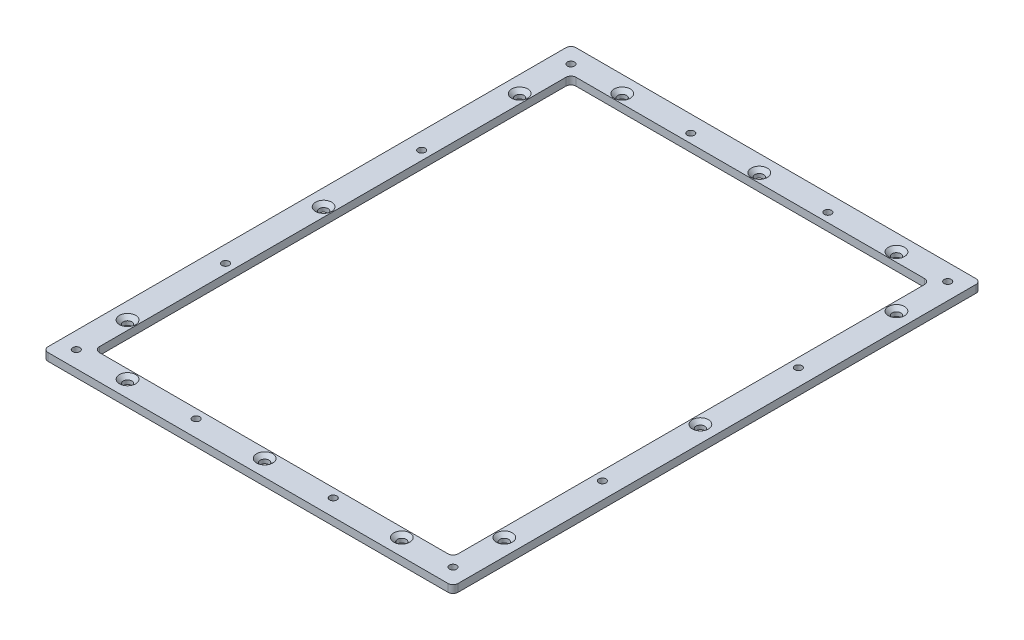
from build123d import *

# Parameters (mm, degrees)
SKETCH1_W                                      = 160
SKETCH1_H                                      = 206
SKETCH1_W_2                                    = 140
SKETCH1_H_2                                    = 186
BOSS_EXTRUDE1_DEPTH                            = 3
FILLET1_R                                      = 2
BOSS_EXTRUDE3_DEPTH                            = 0.5
FILLET2_R                                      = 0.25
SKETCH10_R                                     = 1.7
SKETCH10_R_2                                   = 1.4
CUT_EXTRUDE1_DEPTH                             = 131.465512684
CSK_FOR_M3_FLAT_HEAD_MACHINE_SCREW2_AT_2_COUNT = 2
CSK_FOR_M3_FLAT_HEAD_MACHINE_SCREW2_AT_2_PITCH = 53.5
CSK_FOR_M3_FLAT_HEAD_MACHINE_SCREW2_AT_3_COUNT = 2
CSK_FOR_M3_FLAT_HEAD_MACHINE_SCREW2_AT_3_PITCH = 28.284271247
CSK_FOR_M3_FLAT_HEAD_MACHINE_SCREW2_AT_4_COUNT = 2
CSK_FOR_M3_FLAT_HEAD_MACHINE_SCREW2_AT_4_PITCH = 107
CSK_FOR_M3_FLAT_HEAD_MACHINE_SCREW2_AT_5_COUNT = 2
CSK_FOR_M3_FLAT_HEAD_MACHINE_SCREW2_AT_5_PITCH = 128.565158577
CSK_FOR_M3_FLAT_HEAD_MACHINE_SCREW2_AT_6_COUNT = 2
CSK_FOR_M3_FLAT_HEAD_MACHINE_SCREW2_AT_6_PITCH = 159.503134765
CSK_FOR_M3_FLAT_HEAD_MACHINE_SCREW2_AT_7_COUNT = 2
CSK_FOR_M3_FLAT_HEAD_MACHINE_SCREW2_AT_7_PITCH = 220.676233428
CSK_FOR_M3_FLAT_HEAD_MACHINE_SCREW2_AT_8_COUNT = 2
CSK_FOR_M3_FLAT_HEAD_MACHINE_SCREW2_AT_8_PITCH = 200.277931885
CSK_FOR_M3_FLAT_HEAD_MACHINE_SCREW2_AT_9_COUNT = 2
CSK_FOR_M3_FLAT_HEAD_MACHINE_SCREW2_AT_9_PITCH = 193
CSK_FOR_M3_FLAT_HEAD_MACHINE_SCREW2_AT_1_COUNT = 2
CSK_FOR_M3_FLAT_HEAD_MACHINE_SCREW2_AT_1_PITCH = 174.152232257
CSK_FOR_M3_FLAT_HEAD_MACHINE_SCREW2_2_COUNT    = 2
CSK_FOR_M3_FLAT_HEAD_MACHINE_SCREW2_2_PITCH    = 214.611276498
CSK_FOR_M3_FLAT_HEAD_MACHINE_SCREW2_3_COUNT    = 2
CSK_FOR_M3_FLAT_HEAD_MACHINE_SCREW2_3_PITCH    = 98.550748348


with BuildPart() as part:
    # Sketch1 → Boss-Extrude1 (new body)
    with BuildSketch(Plane(origin=(0, 0, 0), x_dir=(1, 0, 0), z_dir=(0, 1, 0))):
        Rectangle(SKETCH1_W, SKETCH1_H)
        Rectangle(SKETCH1_W_2, SKETCH1_H_2, mode=Mode.SUBTRACT)
    extrude(amount=BOSS_EXTRUDE1_DEPTH)

    # Fillet1
    fillet1_edges = [part.edges().sort_by_distance(p)[0] for p in [
        (70, 1.5, 93),
        (70, 1.5, -93),
        (-70, 1.5, -93),
        (-70, 1.5, 93),
        (-80, 1.5, -103),
        (80, 1.5, -103),
        (80, 1.5, 103),
        (-80, 1.5, 103),
    ]]
    fillet(fillet1_edges, radius=FILLET1_R)

    # Sketch6 → Boss-Extrude3 (add)
    with BuildSketch(Plane.XZ):
        with BuildLine():
            Line((-78, -102), (78, -102))
            ThreePointArc((78, -102), (78.707106781, -101.707106781), (79, -101))
            Line((79, -101), (79, 101))
            ThreePointArc((79, 101), (78.707106781, 101.707106781), (78, 102))
            Line((78, 102), (-78, 102))
            ThreePointArc((-78, 102), (-78.707106781, 101.707106781), (-79, 101))
            Line((-79, 101), (-79, -101))
            ThreePointArc((-79, -101), (-78.707106781, -101.707106781), (-78, -102))
        make_face()
        with BuildLine():
            Line((-78, -101.5), (78, -101.5))
            ThreePointArc((78, -101.5), (78.353553391, -101.353553391), (78.5, -101))
            Line((78.5, -101), (78.5, 101))
            ThreePointArc((78.5, 101), (78.353553391, 101.353553391), (78, 101.5))
            Line((78, 101.5), (-78, 101.5))
            ThreePointArc((-78, 101.5), (-78.353553391, 101.353553391), (-78.5, 101))
            Line((-78.5, 101), (-78.5, -101))
            ThreePointArc((-78.5, -101), (-78.353553391, -101.353553391), (-78, -101.5))
        make_face(mode=Mode.SUBTRACT)
    extrude(amount=BOSS_EXTRUDE3_DEPTH)

    # Fillet2
    fillet2_edges = [part.edges().sort_by_distance(p)[0] for p in [
        (-78.353553391, 0, -101.353553391),
        (-78.5, 0, 0),
        (-78.353553391, 0, 101.353553391),
        (0, 0, 101.5),
        (78.353553391, 0, 101.353553391),
        (78.5, 0, 0),
        (78.353553391, 0, -101.353553391),
        (-78.707106781, 0, -101.707106781),
        (-79, 0, 0),
        (-78.707106781, 0, 101.707106781),
        (0, 0, 102),
        (78.707106781, 0, 101.707106781),
        (79, 0, 0),
        (78.707106781, 0, -101.707106781),
        (0, 0, -101.5),
        (0, 0, -102),
    ]]
    fillet(fillet2_edges, radius=FILLET2_R)
    fillet2_2_edges = [part.edges().sort_by_distance(p)[0] for p in [
        (-79, -0.5, 0),
        (-78.707106781, -0.5, 101.707106781),
        (0, -0.5, 102),
        (78.707106781, -0.5, 101.707106781),
        (79, -0.5, 0),
        (78.707106781, -0.5, -101.707106781),
        (0, -0.5, -102),
        (-78.5, -0.5, 0),
        (-78.353553391, -0.5, 101.353553391),
        (0, -0.5, 101.5),
        (78.353553391, -0.5, 101.353553391),
        (78.5, -0.5, 0),
        (78.353553391, -0.5, -101.353553391),
        (0, -0.5, -101.5),
        (-78.707106781, -0.5, -101.707106781),
        (-78.353553391, -0.5, -101.353553391),
    ]]
    fillet(fillet2_2_edges, radius=FILLET2_R - 0.0001)  # a hair under: the kernel refuses the full size

    # Sketch10 → Cut-Extrude1 (cut, through all)
    with BuildSketch(Plane(origin=(0, 3, 0), x_dir=(1, 0, 0), z_dir=(0, 1, 0))):
        with Locations(Location((0, 96.5, 0), (0, 0, 270))):
            Circle(SKETCH10_R)
        with Locations(Location((-53.5, 96.5, 0), (0, 0, 270))):
            Circle(SKETCH10_R)
        with Locations(Location((-73.5, 76.5, 0), (0, 0, 270))):
            Circle(SKETCH10_R)
        with Locations(Location((-73.5, 0, 0), (0, 0, 270))):
            Circle(SKETCH10_R)
        with Locations(Location((-73.5, -76.5, 0), (0, 0, 270))):
            Circle(SKETCH10_R)
        with Locations(Location((-53.5, -96.5, 0), (0, 0, 270))):
            Circle(SKETCH10_R)
        with Locations(Location((0, -96.5, 0), (0, 0, 270))):
            Circle(SKETCH10_R)
        with Locations(Location((53.5, -96.5, 0), (0, 0, 270))):
            Circle(SKETCH10_R)
        with Locations(Location((73.5, -76.5, 0), (0, 0, 270))):
            Circle(SKETCH10_R)
        with Locations(Location((73.5, 0, 0), (0, 0, 270))):
            Circle(SKETCH10_R)
        with Locations(Location((73.5, 76.5, 0), (0, 0, 270))):
            Circle(SKETCH10_R)
        with Locations(Location((53.5, 96.5, 0), (0, 0, 270))):
            Circle(SKETCH10_R)
        with Locations(Location((73.5, -38.25, 0), (0, 0, 270))):
            Circle(SKETCH10_R_2)
        with Locations(Location((73.5, 38.25, 0), (0, 0, 270))):
            Circle(SKETCH10_R_2)
        with Locations(Location((26.75, 96.5, 0), (0, 0, 270))):
            Circle(SKETCH10_R_2)
        with Locations(Location((-26.75, 96.5, 0), (0, 0, 270))):
            Circle(SKETCH10_R_2)
        with Locations(Location((-73.5, 38.25, 0), (0, 0, 270))):
            Circle(SKETCH10_R_2)
        with Locations(Location((-73.5, -38.25, 0), (0, 0, 270))):
            Circle(SKETCH10_R_2)
        with Locations(Location((-26.75, -96.5, 0), (0, 0, 270))):
            Circle(SKETCH10_R_2)
        with Locations(Location((26.75, -96.5, 0), (0, 0, 270))):
            Circle(SKETCH10_R_2)
        with Locations(Location((-73.5, 96.5, 0), (0, 0, 270))):
            Circle(SKETCH10_R_2)
        with Locations(Location((73.5, 96.5, 0), (0, 0, 270))):
            Circle(SKETCH10_R_2)
        with Locations(Location((73.5, -96.5, 0), (0, 0, 270))):
            Circle(SKETCH10_R_2)
        with Locations(Location((-73.5, -96.5, 0), (0, 0, 270))):
            Circle(SKETCH10_R_2)
    extrude(amount=-CUT_EXTRUDE1_DEPTH, mode=Mode.SUBTRACT)

    # Sketch11 → CSK for M3 Flat Head Machine Screw2 (revolve, cut)
    with BuildSketch(Plane(origin=(-53.5, 3, -96.5), x_dir=(0, 0, 1), z_dir=(1, 0, 0))):
        Polygon((0, 0), (0, 3.5), (1.725, 3.5), (1.7, 3.475), (1.7, 1.45), (3.15, 0), align=None)
    csk_for_m3_flat_head_machine_screw2 = revolve(axis=Axis((-53.5, 9.35, -96.5), (0, -1, 0)), mode=Mode.SUBTRACT)

    # CSK for M3 Flat Head Machine Screw2 at 2: CSK for M3 Flat Head Machine Screw2 ×2
    with Locations(*[(i * CSK_FOR_M3_FLAT_HEAD_MACHINE_SCREW2_AT_2_PITCH, 0, 0) for i in range(1, CSK_FOR_M3_FLAT_HEAD_MACHINE_SCREW2_AT_2_COUNT)]):
        add(csk_for_m3_flat_head_machine_screw2, mode=Mode.SUBTRACT)

    # CSK for M3 Flat Head Machine Screw2 at 3: CSK for M3 Flat Head Machine Screw2 ×2
    with Locations(*[Vector(-0.7071067811865476, 0, 0.7071067811865476) * (i * CSK_FOR_M3_FLAT_HEAD_MACHINE_SCREW2_AT_3_PITCH) for i in range(1, CSK_FOR_M3_FLAT_HEAD_MACHINE_SCREW2_AT_3_COUNT)]):
        add(csk_for_m3_flat_head_machine_screw2, mode=Mode.SUBTRACT)

    # CSK for M3 Flat Head Machine Screw2 at 4: CSK for M3 Flat Head Machine Screw2 ×2
    with Locations(*[(i * CSK_FOR_M3_FLAT_HEAD_MACHINE_SCREW2_AT_4_PITCH, 0, 0) for i in range(1, CSK_FOR_M3_FLAT_HEAD_MACHINE_SCREW2_AT_4_COUNT)]):
        add(csk_for_m3_flat_head_machine_screw2, mode=Mode.SUBTRACT)

    # CSK for M3 Flat Head Machine Screw2 at 5: CSK for M3 Flat Head Machine Screw2 ×2
    with Locations(*[Vector(0.9878259507117183, 0, 0.15556314184436465) * (i * CSK_FOR_M3_FLAT_HEAD_MACHINE_SCREW2_AT_5_PITCH) for i in range(1, CSK_FOR_M3_FLAT_HEAD_MACHINE_SCREW2_AT_5_COUNT)]):
        add(csk_for_m3_flat_head_machine_screw2, mode=Mode.SUBTRACT)

    # CSK for M3 Flat Head Machine Screw2 at 6: CSK for M3 Flat Head Machine Screw2 ×2
    with Locations(*[Vector(0.7962225957926617, 0, 0.6050037834172575) * (i * CSK_FOR_M3_FLAT_HEAD_MACHINE_SCREW2_AT_6_PITCH) for i in range(1, CSK_FOR_M3_FLAT_HEAD_MACHINE_SCREW2_AT_6_COUNT)]):
        add(csk_for_m3_flat_head_machine_screw2, mode=Mode.SUBTRACT)

    # CSK for M3 Flat Head Machine Screw2 at 7: CSK for M3 Flat Head Machine Screw2 ×2
    with Locations(*[Vector(0.4848732386710652, 0, 0.8745844398459376) * (i * CSK_FOR_M3_FLAT_HEAD_MACHINE_SCREW2_AT_7_PITCH) for i in range(1, CSK_FOR_M3_FLAT_HEAD_MACHINE_SCREW2_AT_7_COUNT)]):
        add(csk_for_m3_flat_head_machine_screw2, mode=Mode.SUBTRACT)

    # CSK for M3 Flat Head Machine Screw2 at 8: CSK for M3 Flat Head Machine Screw2 ×2
    with Locations(*[Vector(0.26712878197088863, 0, 0.9636608396332963) * (i * CSK_FOR_M3_FLAT_HEAD_MACHINE_SCREW2_AT_8_PITCH) for i in range(1, CSK_FOR_M3_FLAT_HEAD_MACHINE_SCREW2_AT_8_COUNT)]):
        add(csk_for_m3_flat_head_machine_screw2, mode=Mode.SUBTRACT)

    # CSK for M3 Flat Head Machine Screw2 at 9: CSK for M3 Flat Head Machine Screw2 ×2
    with Locations(*[(0, 0, i * CSK_FOR_M3_FLAT_HEAD_MACHINE_SCREW2_AT_9_PITCH) for i in range(1, CSK_FOR_M3_FLAT_HEAD_MACHINE_SCREW2_AT_9_COUNT)]):
        add(csk_for_m3_flat_head_machine_screw2, mode=Mode.SUBTRACT)

    # CSK for M3 Flat Head Machine Screw2 at 1: CSK for M3 Flat Head Machine Screw2 ×2
    with Locations(*[Vector(-0.11484205364946054, 0, 0.9933837640678321) * (i * CSK_FOR_M3_FLAT_HEAD_MACHINE_SCREW2_AT_1_PITCH) for i in range(1, CSK_FOR_M3_FLAT_HEAD_MACHINE_SCREW2_AT_1_COUNT)]):
        add(csk_for_m3_flat_head_machine_screw2, mode=Mode.SUBTRACT)

    # CSK for M3 Flat Head Machine Screw2  2: CSK for M3 Flat Head Machine Screw2 ×2
    with Locations(*[Vector(0.591767599878765, 0, 0.8061086203072921) * (i * CSK_FOR_M3_FLAT_HEAD_MACHINE_SCREW2_2_PITCH) for i in range(1, CSK_FOR_M3_FLAT_HEAD_MACHINE_SCREW2_2_COUNT)]):
        add(csk_for_m3_flat_head_machine_screw2, mode=Mode.SUBTRACT)

    # CSK for M3 Flat Head Machine Screw2  3: CSK for M3 Flat Head Machine Screw2 ×2
    with Locations(*[Vector(-0.20294112764446817, 0, 0.9791909408845609) * (i * CSK_FOR_M3_FLAT_HEAD_MACHINE_SCREW2_3_PITCH) for i in range(1, CSK_FOR_M3_FLAT_HEAD_MACHINE_SCREW2_3_COUNT)]):
        add(csk_for_m3_flat_head_machine_screw2, mode=Mode.SUBTRACT)


solid = part.part
